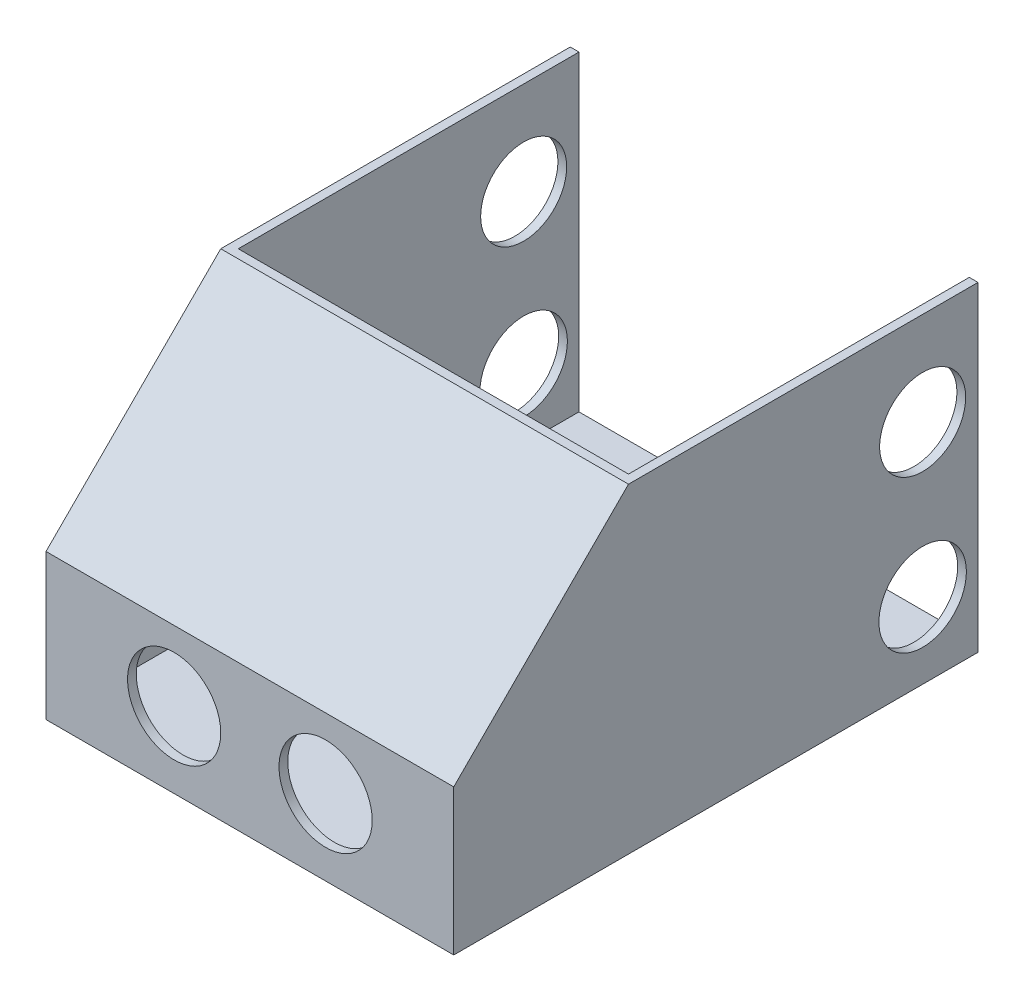
from build123d import *

# Parameters (mm, degrees)
ESBO_O1_W                = 70
ESBO_O1_H                = 90
RESSALTO_EXTRUS_O1_DEPTH = 55
CHANFRO1_SIZE            = 30
ESBO_O3_W                = 67
ESBO_O3_H                = 53.5
CORTE_EXTRUS_O1_DEPTH    = 58.5
ESBO_O5_W                = 67
ESBO_O5_H                = 22.5
CORTE_EXTRUS_O3_DEPTH    = 30
CHANFRO2_SIZE            = 31
ESBO_O4_R                = 8
CORTE_EXTRUS_O4_DEPTH    = 112.130553854
ESBO_O6_R                = 7.509542532
ESBO_O6_R_2              = 7.382654188
CORTE_EXTRUS_O5_DEPTH    = 100.749686716


with BuildPart() as part:
    # Esboço1 → Ressalto-extrusão1 (new body)
    with BuildSketch(Plane(origin=(0, 0, 0), x_dir=(1, 0, 0), z_dir=(0, 1, 0))):
        Rectangle(ESBO_O1_W, ESBO_O1_H)
    extrude(amount=RESSALTO_EXTRUS_O1_DEPTH)

    # Chanfro1
    chanfro1_edges = [part.edges().sort_by_distance(p)[0] for p in [
        (0, 55, 45),
    ]]
    chamfer(chanfro1_edges, length=CHANFRO1_SIZE)

    # Esboço3 → Corte-extrusão1 (cut)
    with BuildSketch(Plane(origin=(0, 0, -45), x_dir=(-1, 0, 0), z_dir=(0, 0, -1))):
        with Locations((0, 28.25)):
            Rectangle(ESBO_O3_W, ESBO_O3_H)
    extrude(amount=-CORTE_EXTRUS_O1_DEPTH, mode=Mode.SUBTRACT)

    # Esboço5 → Corte-extrusão3 (cut)
    with BuildSketch(Plane(origin=(0, 0, 13.5), x_dir=(-1, 0, 0), z_dir=(0, 0, -1))):
        with Locations((0, 12.75)):
            Rectangle(ESBO_O5_W, ESBO_O5_H)
    extrude(amount=-CORTE_EXTRUS_O3_DEPTH, mode=Mode.SUBTRACT)

    # Chanfro2
    # the kernel refuses this chamfer: 31 mm, written as the material it takes off along each edge
    with BuildSketch(Plane(origin=(-33.5, 24, 13.5), x_dir=(0, -0.027495876610586407, 0.9996219169112968), z_dir=(1, 0, 0))) as chanfro2_piece_1_section:
        Polygon((CHANFRO2_SIZE * 0.999621916911, -CHANFRO2_SIZE * 0.0274958766106), (-CHANFRO2_SIZE * 0.0274958766106, -CHANFRO2_SIZE * 0.999621916911), (0, 0), align=None)
    chanfro2_piece_1 = extrude(amount=67, mode=Mode.PRIVATE)
    chanfro2_piece_1 = split(chanfro2_piece_1, bisect_by=Plane(origin=(0, 34.34375, 43.5), z_dir=(0, 0, -1)), keep=Keep.TOP, mode=Mode.PRIVATE)
    add(chanfro2_piece_1, mode=Mode.SUBTRACT)

    # Esboço4 → Corte-extrusão4 (cut, through all)
    with BuildSketch(Plane.XY.offset(45)):
        with Locations((13, 13)):
            Circle(ESBO_O4_R)
        with Locations((-13, 13)):
            Circle(ESBO_O4_R)
    extrude(amount=-CORTE_EXTRUS_O4_DEPTH, mode=Mode.SUBTRACT)

    # Esboço6 → Corte-extrusão5 (cut, through all)
    with BuildSketch(Plane(origin=(35, 0, 0), x_dir=(0, 0, -1), z_dir=(1, 0, 0))):
        with Locations((35.5, 13)):
            Circle(ESBO_O6_R)
        with Locations((35.5, 39)):
            Circle(ESBO_O6_R_2)
    extrude(amount=-CORTE_EXTRUS_O5_DEPTH, mode=Mode.SUBTRACT)


solid = part.part
